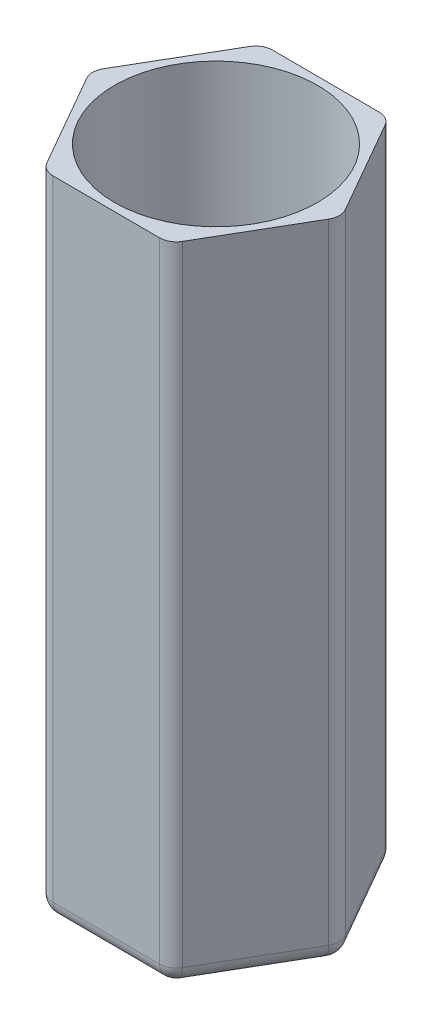
from build123d import *

# Parameters (mm, degrees)
BOSS_EXTRUDE1_DEPTH      = 98.425
SKETCH3_R                = 15.478125
CUT_EXTRUDE1_DEPTH       = 85.725
FILLET1_R                = 1.27
FILLET2_R                = 2.54
FILLET3_R                = 2.54
BOSS_EXTRUDE3_DEPTH      = 0.79375
BOSS_EXTRUDE3_DEPTH_BACK = 3.175
SKETCH7_R                = 1.5875
CUT_EXTRUDE2_START       = -0.635
SKETCH8_R                = 1.5875
CUT_EXTRUDE2_DEPTH       = 0.635
FILLET4_R                = 1.524
FILLET5_R                = 0.254


with BuildPart() as part:
    # Sketch2 → Boss-Extrude1 (new body)
    with BuildSketch(Plane(origin=(0, 0, 0), x_dir=(1, 0, 0), z_dir=(0, 1, 0))):
        Polygon((9.562214756, -16.704101823), (19.247283904, -0.070930017), (9.685069148, 16.633171806), (-9.562214756, 16.704101823), (-19.247283904, 0.070930017), (-9.685069148, -16.633171806), align=None)
    extrude(amount=BOSS_EXTRUDE1_DEPTH)

    # Sketch3 → Cut-Extrude1 (cut)
    with BuildSketch(Plane(origin=(0, 98.425, 0), x_dir=(1, 0, 0), z_dir=(0, 1, 0))):
        with Locations(Location((0, 0, 0), (0, 0, 270))):
            Circle(SKETCH3_R)
    extrude(amount=-CUT_EXTRUDE1_DEPTH, mode=Mode.SUBTRACT)

    # Fillet1
    fillet1_edges = [part.edges().sort_by_distance(p)[0] for p in [
        (0, 12.7, -15.478125),
    ]]
    fillet(fillet1_edges, radius=FILLET1_R)

    # Fillet2
    fillet2_edges = [part.edges().sort_by_distance(p)[0] for p in [
        (-14.466176526, 0, 8.281120895),
        (-14.40474933, 0, -8.38751592),
        (0.061427196, 0, -16.668636815),
        (14.466176526, 0, -8.281120895),
        (14.40474933, 0, 8.38751592),
        (-0.061427196, 0, 16.668636815),
    ]]
    fillet(fillet2_edges, radius=FILLET2_R)

    # Fillet3
    # the kernel refuses this fillet: 2.54 mm, written as the material it takes off along each edge
    with BuildSketch(Plane(origin=(-16.314364452, 2.54, -0.060121633), x_dir=(-0.8678621088062781, 0, 0.49680515305129436), z_dir=(0, -1, 0))) as fillet3_piece_1_section:
        Polygon((0, 0), (FILLET3_R, 0), (FILLET3_R, FILLET3_R * 0.57735026919), (FILLET3_R * 0.5, FILLET3_R * 0.866025403784), align=None)
    fillet3_piece_1 = extrude(amount=FILLET3_R, mode=Mode.PRIVATE)
    fillet3_piece_1 = fillet3_piece_1 - Plane(origin=(-16.314364452, 2.54, -0.060121633), x_dir=(0.9999932097338184, 0, 0.003685171129701924), z_dir=(0, -1, 0)) * Sphere(FILLET3_R, mode=Mode.PRIVATE)
    add(fillet3_piece_1, mode=Mode.SUBTRACT)
    with BuildSketch(Plane(origin=(-8.105115364, 2.54, -14.158714879), x_dir=(0.003685171129702339, 0, -0.9999932097338186), z_dir=(0, -1, 0))) as fillet3_piece_2_section:
        Polygon((0, 0), (FILLET3_R, 0), (FILLET3_R, -FILLET3_R * 0.57735026919), (FILLET3_R * 0.5, -FILLET3_R * 0.866025403784), align=None)
    fillet3_piece_2 = extrude(amount=FILLET3_R, mode=Mode.PRIVATE)
    fillet3_piece_2 = fillet3_piece_2 - Plane(origin=(-8.105115364, 2.54, -14.158714879), x_dir=(0.49680515305129425, 0, 0.867862108806278), z_dir=(0, -1, 0)) * Sphere(FILLET3_R, mode=Mode.PRIVATE)
    add(fillet3_piece_2, mode=Mode.SUBTRACT)
    with BuildSketch(Plane(origin=(-8.209249088, 2.54, 14.098593245), x_dir=(-0.003685171129702708, 0, 0.9999932097338186), z_dir=(0, -1, 0))) as fillet3_piece_3_section:
        Polygon((0, 0), (FILLET3_R, 0), (FILLET3_R, FILLET3_R * 0.57735026919), (FILLET3_R * 0.5, FILLET3_R * 0.866025403784), align=None)
    fillet3_piece_3 = extrude(amount=FILLET3_R, mode=Mode.PRIVATE)
    fillet3_piece_3 = fillet3_piece_3 - Plane(origin=(-8.209249088, 2.54, 14.098593245), x_dir=(0.5031880566825245, 0, -0.8641769376765759), z_dir=(0, -1, 0)) * Sphere(FILLET3_R, mode=Mode.PRIVATE)
    add(fillet3_piece_3, mode=Mode.SUBTRACT)
    with BuildSketch(Plane(origin=(8.209249088, 2.54, -14.098593245), x_dir=(0.8678621088062781, 0, -0.49680515305129436), z_dir=(0, -1, 0))) as fillet3_piece_4_section:
        Polygon((0, 0), (FILLET3_R, 0), (FILLET3_R, -FILLET3_R * 0.57735026919), (FILLET3_R * 0.5, -FILLET3_R * 0.866025403784), align=None)
    fillet3_piece_4 = extrude(amount=FILLET3_R, mode=Mode.PRIVATE)
    fillet3_piece_4 = fillet3_piece_4 - Plane(origin=(8.209249088, 2.54, -14.098593245), x_dir=(-0.5031880566825243, 0, 0.8641769376765759), z_dir=(0, -1, 0)) * Sphere(FILLET3_R, mode=Mode.PRIVATE)
    add(fillet3_piece_4, mode=Mode.SUBTRACT)
    with BuildSketch(Plane(origin=(8.105115364, 2.54, 14.158714879), x_dir=(0.8641769376765761, 0, 0.5031880566825242), z_dir=(0, -1, 0))) as fillet3_piece_5_section:
        Polygon((0, 0), (FILLET3_R, 0), (FILLET3_R, FILLET3_R * 0.57735026919), (FILLET3_R * 0.5, FILLET3_R * 0.866025403784), align=None)
    fillet3_piece_5 = extrude(amount=FILLET3_R, mode=Mode.PRIVATE)
    fillet3_piece_5 = fillet3_piece_5 - Plane(origin=(8.105115364, 2.54, 14.158714879), x_dir=(-0.4968051530512941, 0, -0.8678621088062782), z_dir=(0, -1, 0)) * Sphere(FILLET3_R, mode=Mode.PRIVATE)
    add(fillet3_piece_5, mode=Mode.SUBTRACT)
    with BuildSketch(Plane(origin=(16.314364452, 2.54, 0.060121633), x_dir=(0.8641769376765761, 0, 0.5031880566825242), z_dir=(0, -1, 0))) as fillet3_piece_6_section:
        Polygon((0, 0), (FILLET3_R, 0), (FILLET3_R, -FILLET3_R * 0.57735026919), (FILLET3_R * 0.5, -FILLET3_R * 0.866025403784), align=None)
    fillet3_piece_6 = extrude(amount=FILLET3_R, mode=Mode.PRIVATE)
    fillet3_piece_6 = fillet3_piece_6 - Plane(origin=(16.314364452, 2.54, 0.060121633), x_dir=(-0.9999932097338184, 0, -0.003685171129701988), z_dir=(0, -1, 0)) * Sphere(FILLET3_R, mode=Mode.PRIVATE)
    add(fillet3_piece_6, mode=Mode.SUBTRACT)
    with BuildSketch(Plane(origin=(-9.685069148, 2.54, 16.633171806), x_dir=(0.9999932097338186, 0, 0.0036851711297037465), z_dir=(0, 1, 0)), Plane(origin=(-19.247283904, 2.54, -0.070930017), x_dir=(0.49680515305129397, 0, 0.8678621088062782), z_dir=(0, 1, 0)), Plane(origin=(9.562214756, 2.54, 16.704101823), x_dir=(0.5031880566825245, 0, -0.8641769376765758), z_dir=(0, 1, 0))) as fillet3_piece_7:
        with BuildLine():
            CenterArc((FILLET3_R * 0.57735026919, FILLET3_R), FILLET3_R, 210, 60)
            Line((-FILLET3_R * 0.288675134595, FILLET3_R * 0.5), (0, 0))
            Line((0, 0), (FILLET3_R * 0.57735026919, 0))
        make_face()
    extrude(amount=99.551174209, mode=Mode.SUBTRACT)
    with BuildSketch(Plane(origin=(-9.562214756, 2.54, -16.704101823), x_dir=(0.9999932097338186, 0, 0.003685171129701324), z_dir=(0, 1, 0)), Plane(origin=(9.685069148, 2.54, -16.633171806), x_dir=(0.4968051530512946, 0, 0.8678621088062779), z_dir=(0, 1, 0)), Plane(origin=(19.247283904, 2.54, 0.070930017), x_dir=(-0.503188056682524, 0, 0.8641769376765761), z_dir=(0, 1, 0))) as fillet3_piece_8:
        with BuildLine():
            CenterArc((FILLET3_R * 0.57735026919, -FILLET3_R), FILLET3_R, 90, 60)
            Line((-FILLET3_R * 0.288675134595, -FILLET3_R * 0.5), (0, 0))
            Line((0, 0), (FILLET3_R * 0.57735026919, 0))
        make_face()
    extrude(amount=99.551174209, mode=Mode.SUBTRACT)

    # Sketch7 → Boss-Extrude3 (add, two sides: drawn at the far end of the back side and taken through both)
    with BuildSketch(Plane.XY.offset(15.478125).offset(-BOSS_EXTRUDE3_DEPTH_BACK)):
        with Locations(Location((0, 95.25, 0), (0, 0, 270))):
            Circle(SKETCH7_R)
    extrude(amount=BOSS_EXTRUDE3_DEPTH + BOSS_EXTRUDE3_DEPTH_BACK)

    # Sketch8 → Cut-Extrude2 (cut)
    with BuildSketch(Plane(origin=(0, 0, 12.303125), x_dir=(-1, 0, 0), z_dir=(0, 0, -1)).offset(CUT_EXTRUDE2_START)):
        with Locations((0, 95.25)):
            Circle(SKETCH8_R)
    extrude(amount=CUT_EXTRUDE2_DEPTH, mode=Mode.SUBTRACT)

    # Fillet4
    fillet4_edges = [part.edges().sort_by_distance(p)[0] for p in [
        (0, 96.8375, 12.938125),
    ]]
    fillet(fillet4_edges, radius=FILLET4_R)

    # Fillet5
    fillet5_edges = [part.edges().sort_by_distance(p)[0] for p in [
        (1.5875, 95.25, 15.396499513),
    ]]
    fillet(fillet5_edges, radius=FILLET5_R)


solid = part.part
